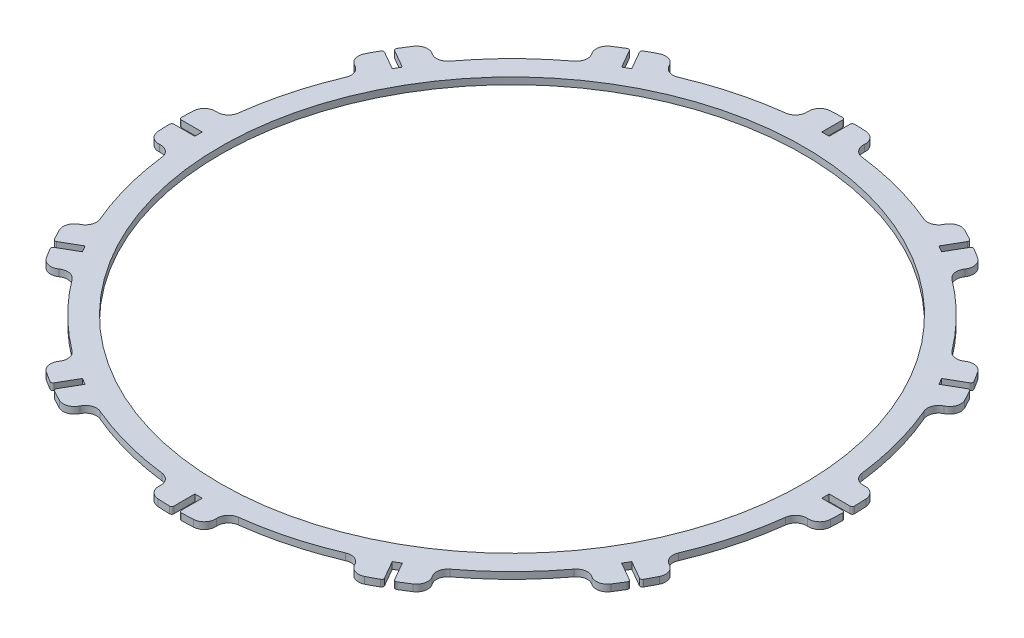
from build123d import *

# Parameters (mm, degrees)
SKETCH1_R                = 150
SKETCH1_R_2              = 130
BOSS_EXTRUDE1_DEPTH      = 3
SKETCH2_W                = 3.3
SKETCH2_H                = 12.624935537
CUT_EXTRUDE1_DEPTH       = 3
FILLET1_R                = 1
CIRPATTERN1_COUNT        = 12
FILLET1_OF_CIRPATTERN1_R = 1
CUT_EXTRUDE2_START       = -10
CUT_EXTRUDE2_DEPTH       = 10
FILLET2_R                = 5
CIRPATTERN2_COUNT        = 12
FILLET2_OF_CIRPATTERN2_R = 5


with BuildPart() as part:
    # Sketch1 → Boss-Extrude1 (new body)
    with BuildSketch(Plane(origin=(0, 0, 0), x_dir=(1, 0, 0), z_dir=(0, 1, 0))):
        with Locations(Location((0, 0, 0), (0, 0, 270))):
            Circle(SKETCH1_R)
        with Locations(Location((0, 0, 0), (0, 0, 270))):
            Circle(SKETCH1_R_2, mode=Mode.SUBTRACT)
    extrude(amount=BOSS_EXTRUDE1_DEPTH)

    # Sketch2 → Cut-Extrude1 (cut)
    with BuildSketch(Plane(origin=(0, 3, 0), x_dir=(1, 0, 0), z_dir=(0, 1, 0))):
        with Locations((0, 146.012467769)):
            Rectangle(SKETCH2_W, SKETCH2_H)
    cut_extrude1 = extrude(amount=-CUT_EXTRUDE1_DEPTH, mode=Mode.SUBTRACT)

    # Fillet1
    fillet1_edges = [part.edges().sort_by_distance(p)[0] for p in [
        (-1.65, 1.5, -149.990924725),
        (1.65, 1.5, -149.990924725),
    ]]
    fillet(fillet1_edges, radius=FILLET1_R)

    # CirPattern1: Cut-Extrude1 ×12 about axis
    cirpattern1_axis = Axis((0, 0, 0), (0, 1, 0))
    for i in range(1, CIRPATTERN1_COUNT):
        add(cut_extrude1.rotate(cirpattern1_axis, i * 360 / CIRPATTERN1_COUNT), mode=Mode.SUBTRACT)

    # Fillet1 of CirPattern1
    fillet1_of_cirpattern1_edges = [part.edges().sort_by_distance(p)[0] for p in [
        (-76.424404279, 1.5, -129.070951149),
        (-73.566520446, 1.5, -130.720951149),
        (-130.720951149, 1.5, -73.566520446),
        (-129.070951149, 1.5, -76.424404279),
        (-149.990924725, 1.5, 1.65),
        (-149.990924725, 1.5, -1.65),
        (-129.070951149, 1.5, 76.424404279),
        (-130.720951149, 1.5, 73.566520446),
        (-73.566520446, 1.5, 130.720951149),
        (-76.424404279, 1.5, 129.070951149),
        (1.65, 1.5, 149.990924725),
        (-1.65, 1.5, 149.990924725),
        (76.424404279, 1.5, 129.070951149),
        (73.566520446, 1.5, 130.720951149),
        (130.720951149, 1.5, 73.566520446),
        (129.070951149, 1.5, 76.424404279),
        (149.990924725, 1.5, -1.65),
        (149.990924725, 1.5, 1.65),
        (129.070951149, 1.5, -76.424404279),
        (130.720951149, 1.5, -73.566520446),
        (73.566520446, 1.5, -130.720951149),
        (76.424404279, 1.5, -129.070951149),
    ]]
    fillet(fillet1_of_cirpattern1_edges, radius=FILLET1_OF_CIRPATTERN1_R)

    # Sketch3 → Cut-Extrude2 (cut)
    with BuildSketch(Plane(origin=(0, 3, 0), x_dir=(1, 0, 0), z_dir=(0, 1, 0)).offset(CUT_EXTRUDE2_START)):
        with BuildLine():
            Line((12.201803985, 139.467257733), (13.073361412, 149.429204714))
            ThreePointArc((13.073361412, 149.429204714), (38.822856765, 144.888873943), (63.392739261, 135.946168055))
            Line((63.392739261, 135.946168055), (59.166556644, 126.883090185))
            ThreePointArc((59.166556644, 126.883090185), (36.234666314, 135.22961568), (12.201803985, 139.467257733))
        make_face()
    cut_extrude2 = extrude(amount=CUT_EXTRUDE2_DEPTH, mode=Mode.SUBTRACT)

    # Fillet2
    fillet2_edges = [part.edges().sort_by_distance(p)[0] for p in [
        (63.392739261, 1.5, -135.946168055),
        (13.073361412, 1.5, -149.429204714),
        (12.201803985, 1.5, -139.467257733),
        (59.166556644, 1.5, -126.883090185),
    ]]
    fillet(fillet2_edges, radius=FILLET2_R - 0.0001)  # a hair under: the kernel refuses the full size

    # CirPattern2: Cut-Extrude2 ×12 about axis
    cirpattern2_axis = Axis((0, 0, 0), (0, 1, 0))
    for i in range(1, CIRPATTERN2_COUNT):
        add(cut_extrude2.rotate(cirpattern2_axis, i * 360 / CIRPATTERN2_COUNT), mode=Mode.SUBTRACT)

    # Fillet2 of CirPattern2
    fillet2_of_cirpattern2_edges = [part.edges().sort_by_distance(p)[0] for p in [
        (-13.073361412, 1.5, -149.429204714),
        (-63.392739261, 1.5, -135.946168055),
        (-59.166556644, 1.5, -126.883090185),
        (-12.201803985, 1.5, -139.467257733),
        (-86.036465453, 1.5, -122.872806643),
        (-122.872806643, 1.5, -86.036465453),
        (-114.6812862, 1.5, -80.300701089),
        (-80.300701089, 1.5, -114.6812862),
        (-135.946168055, 1.5, -63.392739261),
        (-149.429204714, 1.5, -13.073361412),
        (-139.467257733, 1.5, -12.201803985),
        (-126.883090185, 1.5, -59.166556644),
        (-149.429204714, 1.5, 13.073361412),
        (-135.946168055, 1.5, 63.392739261),
        (-126.883090185, 1.5, 59.166556644),
        (-139.467257733, 1.5, 12.201803985),
        (-122.872806643, 1.5, 86.036465453),
        (-86.036465453, 1.5, 122.872806643),
        (-80.300701089, 1.5, 114.6812862),
        (-114.6812862, 1.5, 80.300701089),
        (-63.392739261, 1.5, 135.946168055),
        (-13.073361412, 1.5, 149.429204714),
        (-12.201803985, 1.5, 139.467257733),
        (-59.166556644, 1.5, 126.883090185),
        (13.073361412, 1.5, 149.429204714),
        (63.392739261, 1.5, 135.946168055),
        (59.166556644, 1.5, 126.883090185),
        (12.201803985, 1.5, 139.467257733),
        (86.036465453, 1.5, 122.872806643),
        (122.872806643, 1.5, 86.036465453),
        (114.6812862, 1.5, 80.300701089),
        (80.300701089, 1.5, 114.6812862),
        (135.946168055, 1.5, 63.392739261),
        (149.429204714, 1.5, 13.073361412),
        (139.467257733, 1.5, 12.201803985),
        (126.883090185, 1.5, 59.166556644),
        (149.429204714, 1.5, -13.073361412),
        (135.946168055, 1.5, -63.392739261),
        (126.883090185, 1.5, -59.166556644),
        (139.467257733, 1.5, -12.201803985),
        (122.872806643, 1.5, -86.036465453),
        (86.036465453, 1.5, -122.872806643),
        (80.300701089, 1.5, -114.6812862),
        (114.6812862, 1.5, -80.300701089),
    ]]
    fillet(fillet2_of_cirpattern2_edges, radius=FILLET2_OF_CIRPATTERN2_R - 0.0001)  # a hair under: the kernel refuses the full size


solid = part.part
